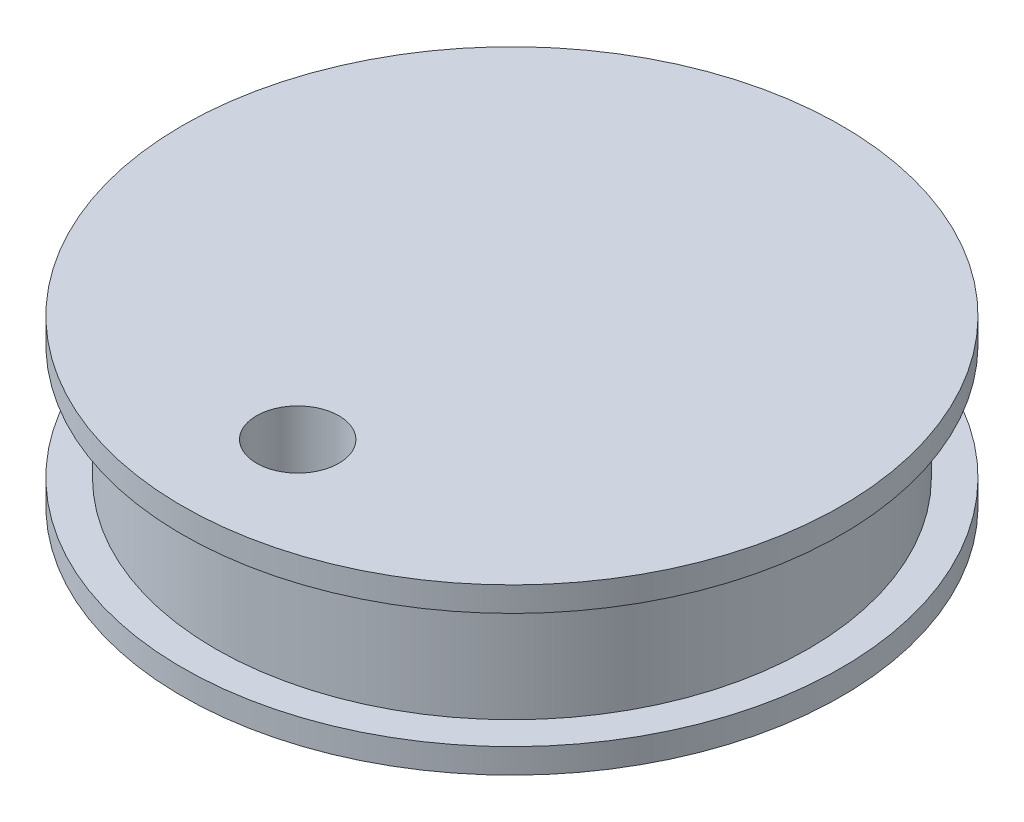
from build123d import *

# Parameters (mm, degrees)
SKETCH4_R          = 3.175
CUT_EXTRUDE1_DEPTH = 59.198711326


with BuildPart() as part:
    # Sketch3 → Revolve1 (revolve)
    with BuildSketch(Plane.XY):
        Polygon((25.4, -1.361443582), (50.8, -1.361443582), (50.8, 0.543556418), (48.26, 0.543556418), (48.26, 9.433556418), (50.8, 9.433556418), (50.8, 11.338556418), (25.4, 11.338556418), align=None)
    revolve(axis=Axis((25.4, 11.338556418, 0), (0, -1, 0)))

    # Sketch4 → Cut-Extrude1 (cut, through all)
    with BuildSketch(Plane(origin=(0, 11.338556418, 0), x_dir=(1, 0, 0), z_dir=(0, 1, 0))):
        with Locations((25.4, -16.51)):
            Circle(SKETCH4_R)
    extrude(amount=-CUT_EXTRUDE1_DEPTH, mode=Mode.SUBTRACT)


solid = part.part
